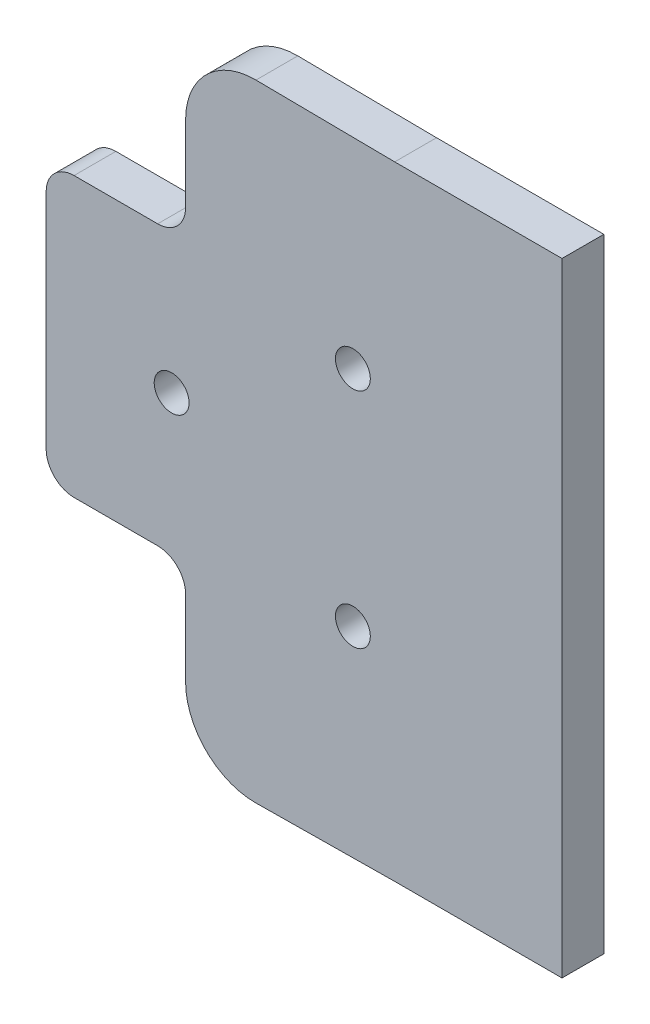
from build123d import *

# Parameters (mm, degrees)
SKETCH1_R           = 1.25
BOSS_EXTRUDE1_DEPTH = 1.5


with BuildPart() as part:
    # Sketch1 → Boss-Extrude1 (new, symmetric)
    with BuildSketch(Plane.XY):
        with BuildLine():
            ThreePointArc((6.131767987, 24.876102332), (2.564962353, 23.428955473), (1.083328706, 19.876336974))
            Line((1.083328706, 19.876336974), (1.083328706, 14.420285823))
            ThreePointArc((1.083328706, 14.420285823), (0.497542269, 13.006072261), (-0.916671294, 12.420285823))
            Line((-0.916671294, 12.420285823), (-6.916671294, 12.420285823))
            ThreePointArc((-6.916671294, 12.420285823), (-8.330884856, 11.834499385), (-8.916671294, 10.420285823))
            Line((-8.916671294, 10.420285823), (-8.916671294, -5.579714177))
            ThreePointArc((-8.916671294, -5.579714177), (-8.330884856, -6.993927739), (-6.916671294, -7.579714177))
            Line((-6.916671294, -7.579714177), (-0.916671294, -7.579714177))
            ThreePointArc((-0.916671294, -7.579714177), (0.497542269, -8.165500615), (1.083328706, -9.579714177))
            Line((1.083328706, -9.579714177), (1.083328706, -15.035765328))
            ThreePointArc((1.083328706, -15.035765328), (2.564962353, -18.588383827), (6.131767987, -20.035530686))
            add(Edge.make_bspline(
                [(6.131767987, -20.035530686), (9.248092377, -20.005338767), (12.570832777, -19.968565053), (16.083328706, -19.927626228)],
                knots=[0.046327938, 0.046327938, 0.046327938, 0.046327938, 0.128883425, 0.128883425, 0.128883425, 0.128883425], degree=3))
            Line((16.083328706, -19.927626228), (28.083328706, -19.927626228))
            Line((28.083328706, -19.927626228), (28.083328706, 24.768197874))
            Line((28.083328706, 24.768197874), (16.083328706, 24.768197874))
            add(Edge.make_bspline(
                [(16.083328706, 24.768197874), (12.570832777, 24.809136699), (9.248092377, 24.845910412), (6.131767987, 24.876102332)],
                knots=[0.046327938, 0.046327938, 0.046327938, 0.046327938, 0.128883425, 0.128883425, 0.128883425, 0.128883425], degree=3))
        make_face()
        with Locations((0.083328706, 2.420285823)):
            Circle(SKETCH1_R, mode=Mode.SUBTRACT)
        with Locations((13.083328706, -5.579714177)):
            Circle(SKETCH1_R, mode=Mode.SUBTRACT)
        with Locations((13.083328706, 10.420285823)):
            Circle(SKETCH1_R, mode=Mode.SUBTRACT)
    extrude(amount=BOSS_EXTRUDE1_DEPTH, both=True)


solid = part.part
